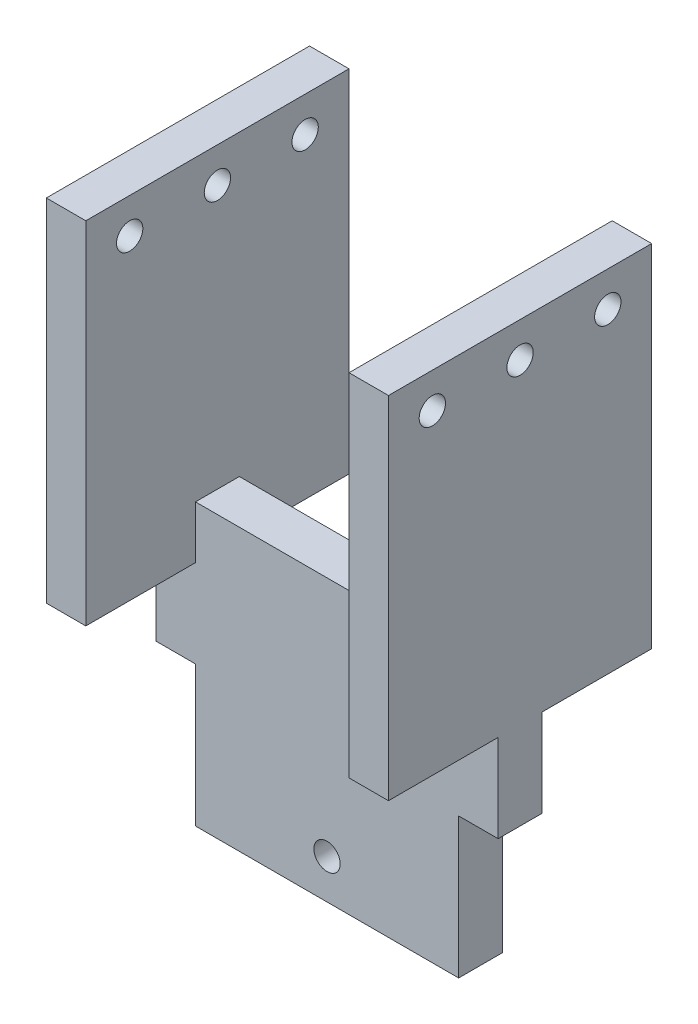
from build123d import *

# Parameters (mm, degrees)
SKETCH_1_W          = 30
SKETCH_1_H          = 50
EXTRUDE_1_DEPTH     = 5
SKETCH_5_W          = 30
SKETCH_5_H          = 50
EXTRUDE_2_DEPTH     = 4.5
SKETCH_6_R          = 1.5
CUT_EXTRUDE_1_DEPTH = 73.857738093
SKETCH_7_R          = 1.5
CUT_EXTRUDE_2_DEPTH = 73.857738093
SKETCH_10_R         = 1.5
CUT_EXTRUDE_3_DEPTH = 65.556177086
SKETCH_14_W         = 38.694799485
SKETCH_14_H         = 18
CUT_EXTRUDE_7_DEPTH = 65.556177086
SKETCH_12_W         = 12.5
SKETCH_12_H         = 10
CUT_EXTRUDE_8_DEPTH = 71.551399703
SKETCH_13_W         = 12.5
SKETCH_13_H         = 10
CUT_EXTRUDE_9_DEPTH = 71.551399703


with BuildPart() as part:
    # 草图1 → 凸台-拉伸1 (new body)
    with BuildSketch(Plane.XY):
        Rectangle(SKETCH_1_W, SKETCH_1_H)
    extrude(amount=EXTRUDE_1_DEPTH)

    # 草图5 → 凸台-拉伸2 (add)
    with BuildSketch(Plane.ZY.offset(15)):
        with Locations((2.5, 34)):
            Rectangle(SKETCH_5_W, SKETCH_5_H)
    extrude_2 = extrude(amount=EXTRUDE_2_DEPTH)

    # 镜向1: 凸台-拉伸2 across plane
    add(extrude_2.mirror(Plane(origin=(0, 0, 0), x_dir=(0, 0, 1), z_dir=(1, 0, 0))))

    # 草图6 → 切除-拉伸1 (cut, through all)
    with BuildSketch(Plane.ZY.offset(19.5)):
        with Locations((2.5, 55)):
            Circle(SKETCH_6_R)
    extrude(amount=-CUT_EXTRUDE_1_DEPTH, mode=Mode.SUBTRACT)

    # 草图7 → 切除-拉伸2 (cut, through all)
    with BuildSketch(Plane.ZY.offset(19.5)):
        with Locations((-7.5, 55)):
            Circle(SKETCH_7_R)
        with Locations((12.5, 55)):
            Circle(SKETCH_7_R)
    extrude(amount=-CUT_EXTRUDE_2_DEPTH, mode=Mode.SUBTRACT)

    # 草图10 → 切除-拉伸3 (cut, through all)
    with BuildSketch(Plane(origin=(0, 0, 0), x_dir=(-1, 0, 0), z_dir=(0, 0, -1))):
        with Locations((0, -13.5)):
            Circle(SKETCH_10_R)
        with Locations((0, -2.5)):
            Circle(SKETCH_10_R)
    extrude(amount=-CUT_EXTRUDE_3_DEPTH, mode=Mode.SUBTRACT)

    # 草图14 → 切除-拉伸7 (cut, through all)
    with BuildSketch(Plane(origin=(0, 0, 0), x_dir=(-1, 0, 0), z_dir=(0, 0, -1))):
        with Locations((4.347399742, -16)):
            Rectangle(SKETCH_14_W, SKETCH_14_H)
    extrude(amount=-CUT_EXTRUDE_7_DEPTH, mode=Mode.SUBTRACT)

    # 草图12 → 切除-拉伸8 (cut, through all)
    with BuildSketch(Plane(origin=(-15, 0, 0), x_dir=(0, 0, -1), z_dir=(1, 0, 0))):
        with Locations((6.25, 14)):
            Rectangle(SKETCH_12_W, SKETCH_12_H)
        with Locations((-11.25, 14)):
            Rectangle(SKETCH_12_W, SKETCH_12_H)
    extrude(amount=-CUT_EXTRUDE_8_DEPTH, mode=Mode.SUBTRACT)

    # 草图13 → 切除-拉伸9 (cut, through all)
    with BuildSketch(Plane.ZY.offset(-15)):
        with Locations((11.25, 14)):
            Rectangle(SKETCH_13_W, SKETCH_13_H)
        with Locations((-6.25, 14)):
            Rectangle(SKETCH_13_W, SKETCH_13_H)
    extrude(amount=-CUT_EXTRUDE_9_DEPTH, mode=Mode.SUBTRACT)


solid = part.part
